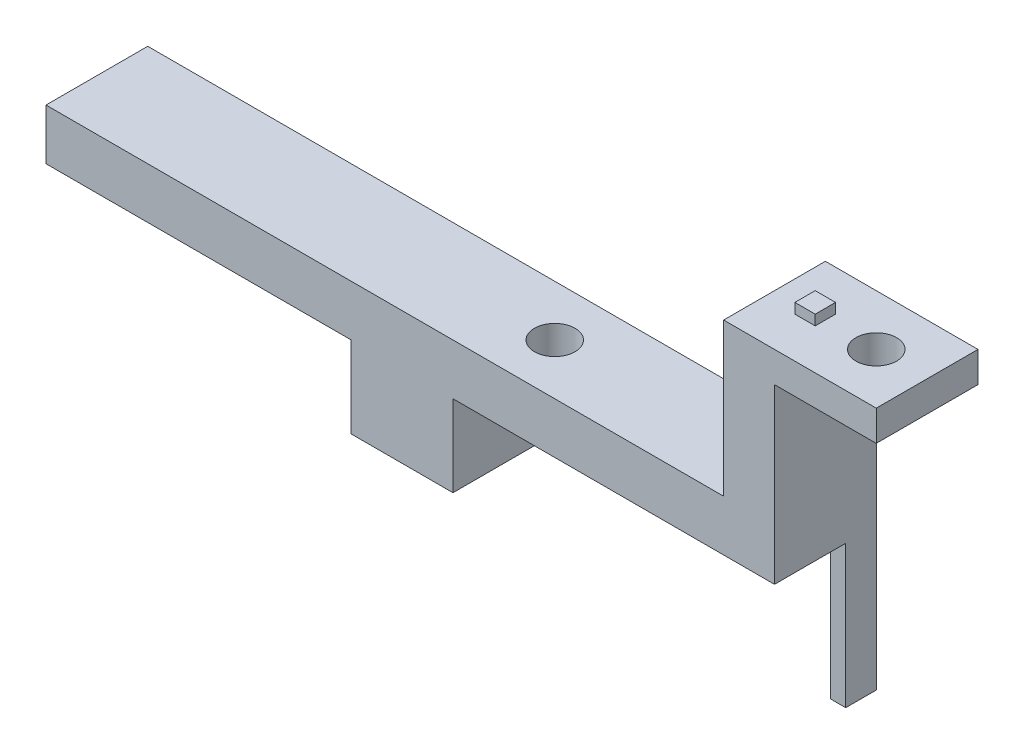
from build123d import *

# Parameters (mm, degrees)
BOSS_EXTRUDE1_DEPTH = 10
SKETCH2_W           = 5.1
SKETCH2_H           = 3.1
CUT_EXTRUDE1_DEPTH  = 10
SKETCH3_W           = 2
SKETCH3_H           = 2
BOSS_EXTRUDE2_DEPTH = 1
CUT_EXTRUDE4_REACH  = 61.553
SKETCH11_R          = 2
SKETCH12_W          = 1.5
SKETCH12_H          = 3
BOSS_EXTRUDE4_DEPTH = 14
SKETCH13_R          = 2
CUT_EXTRUDE6_DEPTH  = 3
SKETCH14_W          = 10
SKETCH14_H          = 5
BOSS_EXTRUDE5_DEPTH = 30


with BuildPart() as part:
    # Sketch1 → Boss-Extrude1 (new body)
    with BuildSketch(Plane.XY):
        Polygon((10, 13), (36.6, 13), (36.6, 28), (51.6, 28), (51.6, 25), (41.6, 25), (41.6, 8), (10, 8), (10, 0), (0, 0), (0, 13), align=None)
    extrude(amount=BOSS_EXTRUDE1_DEPTH)

    # Sketch2 → Cut-Extrude1 (cut)
    with BuildSketch(Plane.XZ):
        with Locations((5, 5)):
            Rectangle(SKETCH2_W, SKETCH2_H)
    extrude(amount=-CUT_EXTRUDE1_DEPTH, mode=Mode.SUBTRACT)

    # Sketch3 → Boss-Extrude2 (add)
    with BuildSketch(Plane(origin=(0, 28, 0), x_dir=(1, 0, 0), z_dir=(0, 1, 0))):
        with Locations((40.6, -5)):
            Rectangle(SKETCH3_W, SKETCH3_H)
    extrude(amount=BOSS_EXTRUDE2_DEPTH)

    # Sketch11 → Cut-Extrude4 (cut, up to next)
    with BuildSketch(Plane(origin=(0, 28, 0), x_dir=(1, 0, 0), z_dir=(0, 1, 0)), mode=Mode.PRIVATE) as cut_extrude4_sk1:
        with Locations((46.6, -5)):
            Circle(SKETCH11_R)
    cut_extrude4_tool1 = extrude(cut_extrude4_sk1.sketch, amount=-CUT_EXTRUDE4_REACH, mode=Mode.PRIVATE) & part.part
    add(cut_extrude4_tool1.solids().sort_by_distance((46.6, 28, 5))[0], mode=Mode.SUBTRACT)

    # Sketch12 → Boss-Extrude4 (add)
    with BuildSketch(Plane.XZ.offset(-8)):
        with Locations((40.85, 1.5)):
            Rectangle(SKETCH12_W, SKETCH12_H)
    extrude(amount=BOSS_EXTRUDE4_DEPTH)

    # Sketch13 → Cut-Extrude6 (cut)
    with BuildSketch(Plane(origin=(0, 13, 0), x_dir=(1, 0, 0), z_dir=(0, 1, 0))):
        with Locations((15, -5)):
            Circle(SKETCH13_R)
    extrude(amount=-CUT_EXTRUDE6_DEPTH, mode=Mode.SUBTRACT)

    # Sketch14 → Boss-Extrude5 (add)
    with BuildSketch(Plane.ZY):
        with Locations((5, 10.5)):
            Rectangle(SKETCH14_W, SKETCH14_H)
    extrude(amount=BOSS_EXTRUDE5_DEPTH)


solid = part.part
